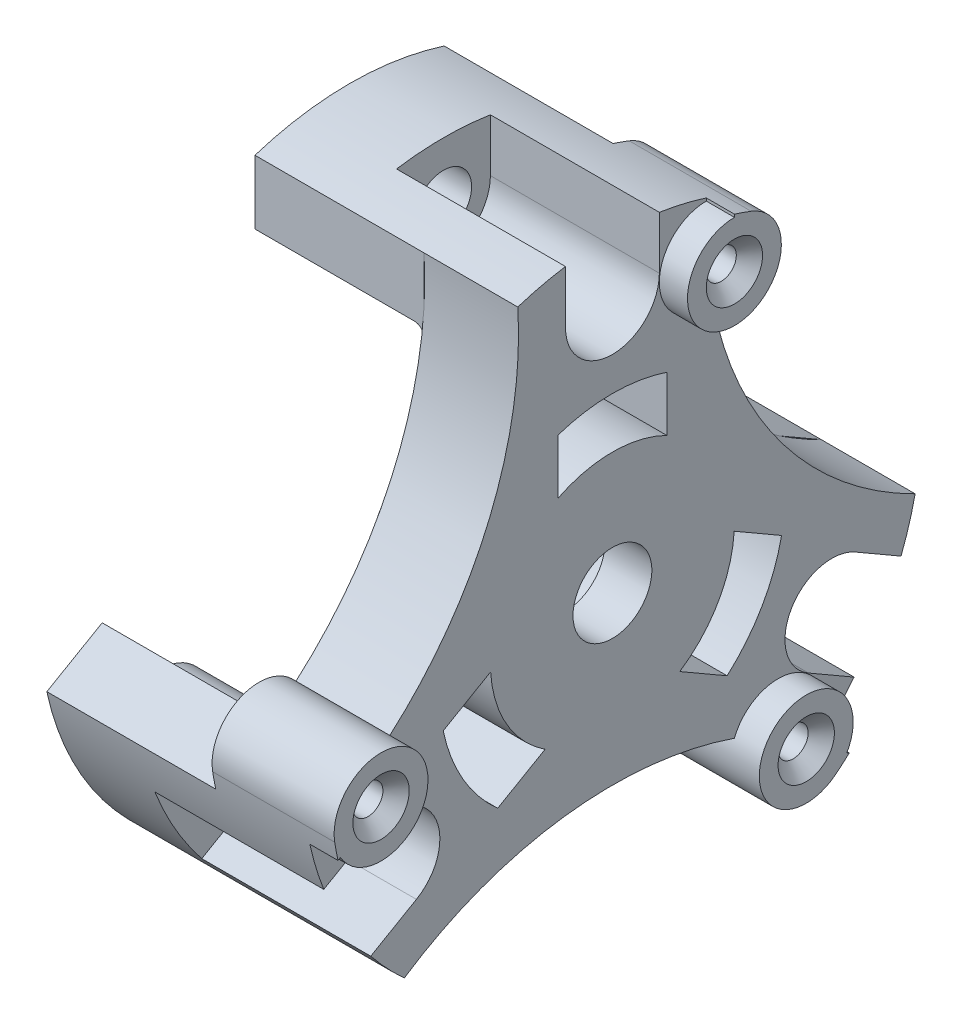
from build123d import *
from build123d.topology import SkipClean

# Parameters (mm, degrees)
SKETCH_2_R                           = 20
CUT_EXTRUDE_1_DEPTH                  = 10
PATTERN_CIRCULAR_1_COUNT             = 3
CUT_EXTRUDE_START                    = -10
CUT_EXTRUDE_2_DEPTH                  = 10
PATTERN_CIRCULAR_2_COUNT             = 3
SKETCH_4_R                           = 1.5
EXTRUDE_1_DEPTH                      = 9
PATTERN_CIRCULAR_3_COUNT             = 3
SKETCH_5_W                           = 6.1
SKETCH_5_H                           = 4.709181557
CUT_EXTRUDE_3_DEPTH                  = 1.5
CUT_EXTRUDE_3_DRAFT                  = -1
PATTERN_CIRCULAR_4_COPY_1_SKETCH_W   = 6.1
PATTERN_CIRCULAR_4_COPY_1_SKETCH_H   = 4.709181557
PATTERN_CIRCULAR_4_COPY_1_DEPTH      = 1.5
PATTERN_CIRCULAR_4_COPY_1_DRAFT      = -1
PATTERN_CIRCULAR_4_COPY_2_SKETCH_W   = 6.1
PATTERN_CIRCULAR_4_COPY_2_SKETCH_H   = 4.709181557
PATTERN_CIRCULAR_4_COPY_2_DEPTH      = 1.5
PATTERN_CIRCULAR_4_COPY_2_DRAFT      = -1
CUT_EXTRUDE_4_DEPTH                  = 9
PATTERN_CIRCULAR_5_COUNT             = 3
EXTRUDE_START                        = -6.5
EXTRUDE_2_DEPTH                      = 6.5
SKETCH_9_R                           = 0.8
CUT_EXTRUDE_7_DEPTH                  = 6.4
CHAMFER_3_SIZE                       = 0.7
PATTERN_CIRCULAR_8_COUNT             = 3
CHAMFER_3_OF_PATTERN_CIRCULAR_8_SIZE = 0.7
CHAMFER_4_SIZE                       = 0.3
FILLET_5_R                           = 0.2
FILLET_6_R                           = 0.5
FILLET_7_R                           = 0.5


with BuildPart() as part:
    # 草图1 → 旋转1 (revolve)
    with BuildSketch(Plane.XY, mode=Mode.PRIVATE) as revolve_1_sk:
        Polygon((-7, 6.5), (-5, 6.5), (-5, 16.5), (0, 16.5), (0, 2.1), (-2.5, 2.1), (-2.5, 4), (-7, 4), align=None)
    revolve(revolve_1_sk.sketch.rotate(Axis((-65.742857143, 0, 0), (1, 0, 0)), 90), axis=Axis((-65.742857143, 0, 0), (1, 0, 0)))

    # 草图2 → 切除-拉伸1 (cut)
    with BuildSketch(Plane.ZY.offset(5)):
        with Locations((-25, 14.43375673)):
            Circle(SKETCH_2_R)
    cut_extrude_1 = extrude(amount=-CUT_EXTRUDE_1_DEPTH, mode=Mode.SUBTRACT)

    # 阵列(圆周)1: 切除-拉伸1 ×3 about axis
    pattern_circular_1_axis = Axis((0, 0, 0), (1, 0, 0))
    for i in range(1, PATTERN_CIRCULAR_1_COUNT):
        add(cut_extrude_1.rotate(pattern_circular_1_axis, i * 360 / PATTERN_CIRCULAR_1_COUNT), mode=Mode.SUBTRACT)

    # 草图3 → 切除-拉伸2 (cut)
    with BuildSketch(Plane.ZY.offset(5).offset(CUT_EXTRUDE_START)):
        with BuildLine():
            Line((-2.9, 8.730979327), (-2.9, 5.817215829))
            ThreePointArc((-2.9, 5.817215829), (0, 6.5), (2.9, 5.817215829))
            Line((2.9, 5.817215829), (2.9, 8.730979327))
            ThreePointArc((2.9, 8.730979327), (0, 9.2), (-2.9, 8.730979327))
        make_face()
    cut_extrude_2 = extrude(amount=CUT_EXTRUDE_2_DEPTH, mode=Mode.SUBTRACT)

    # 阵列(圆周)2: 切除-拉伸2 ×3 about axis
    pattern_circular_2_axis = Axis((0, 0, 0), (1, 0, 0))
    for i in range(1, PATTERN_CIRCULAR_2_COUNT):
        add(cut_extrude_2.rotate(pattern_circular_2_axis, i * 360 / PATTERN_CIRCULAR_2_COUNT), mode=Mode.SUBTRACT)

    # 草图4 → 凸台-拉伸1 (add)
    with BuildSketch(Plane.ZY.offset(5)):
        with BuildLine():
            Line((-5.040834524, 15.711142139), (-5.040834524, 12.307720638))
            ThreePointArc((-5.040834524, 12.307720638), (-3.914741623, 12.710814216), (-2.756988875, 13.011111111))
            ThreePointArc((-2.756988875, 13.011111111), (0, 10.7), (2.756988875, 13.011111111))
            ThreePointArc((2.756988875, 13.011111111), (3.914741623, 12.710814216), (5.040834524, 12.307720638))
            Line((5.040834524, 12.307720638), (5.040834524, 15.711142139))
            ThreePointArc((5.040834524, 15.711142139), (0, 16.5), (-5.040834524, 15.711142139))
        make_face()
        with Locations((0, 13.5)):
            Circle(SKETCH_4_R, mode=Mode.SUBTRACT)
    extrude_1 = extrude(amount=EXTRUDE_1_DEPTH)

    # 阵列(圆周)3: 凸台-拉伸1 ×3 about axis
    pattern_circular_3_axis = Axis((0, 0, 0), (1, 0, 0))
    for i in range(1, PATTERN_CIRCULAR_3_COUNT):
        add(extrude_1.rotate(pattern_circular_3_axis, i * 360 / PATTERN_CIRCULAR_3_COUNT))


with BuildPart() as cut_extrude_3_tool:
    # 草图5 → 切除-拉伸3 (with draft: the straight prism first)
    with BuildSketch(Plane.ZY.offset(14)):
        with Locations((0, 11.645409221)):
            Rectangle(SKETCH_5_W, SKETCH_5_H)
    extrude(amount=-CUT_EXTRUDE_3_DEPTH)
    # 切除-拉伸3: the draft: its side faces are tilted about the plane it starts from
    cut_extrude_3_sides = [cut_extrude_3_tool.faces().sort_by_distance(p)[0] for p in [
        (-13.25, 11.645409222, -3.05),
        (-13.25, 9.290818443, 0),
        (-13.25, 11.645409222, 3.05),
        (-13.25, 14, 0),
    ]]
    draft(cut_extrude_3_sides, Plane.ZY.offset(14), CUT_EXTRUDE_3_DRAFT)


with BuildPart() as part_1:
    add(part.part)

    # 切除-拉伸3: cut by cut_extrude_3_tool
    add(cut_extrude_3_tool.part, mode=Mode.SUBTRACT)


with BuildPart() as pattern_circular_4_copy_1_tool:
    # 阵列(圆周)4 copy 1 sketch → 阵列(圆周)4 copy 1 (with draft: the straight prism first)
    with BuildSketch(Plane(origin=(-14, 0, 0), x_dir=(0, -0.8660254037844387, -0.4999999999999998), z_dir=(-1, 0, 0))):
        with Locations((0, 11.645409221)):
            Rectangle(PATTERN_CIRCULAR_4_COPY_1_SKETCH_W, PATTERN_CIRCULAR_4_COPY_1_SKETCH_H)
    extrude(amount=-PATTERN_CIRCULAR_4_COPY_1_DEPTH)
    # 阵列(圆周)4 copy 1: the draft: its side faces are tilted about the plane it starts from
    pattern_circular_4_copy_1_sides = [pattern_circular_4_copy_1_tool.faces().sort_by_distance(p)[0] for p in [
        (-13.25, -3.181327129, 11.610220224),
        (-13.25, -4.645409221, 8.046084794),
        (-13.25, -8.464082093, 8.560220224),
        (-13.25, -7, 12.124355653),
    ]]
    draft(pattern_circular_4_copy_1_sides, Plane(origin=(-14, 0, 0), x_dir=(0, -0.8660254037844387, -0.4999999999999998), z_dir=(-1, 0, 0)), PATTERN_CIRCULAR_4_COPY_1_DRAFT)


with BuildPart() as part_2:
    add(part_1.part)

    # 阵列(圆周)4 copy 1: cut by pattern_circular_4_copy_1_tool
    add(pattern_circular_4_copy_1_tool.part, mode=Mode.SUBTRACT)


with BuildPart() as pattern_circular_4_copy_2_tool:
    # 阵列(圆周)4 copy 2 sketch → 阵列(圆周)4 copy 2 (with draft: the straight prism first)
    with BuildSketch(Plane(origin=(-14, 0, 0), x_dir=(0, 0.8660254037844384, -0.5000000000000004), z_dir=(-1, 0, 0))):
        with Locations((0, 11.645409221)):
            Rectangle(PATTERN_CIRCULAR_4_COPY_2_SKETCH_W, PATTERN_CIRCULAR_4_COPY_2_SKETCH_H)
    extrude(amount=-PATTERN_CIRCULAR_4_COPY_2_DEPTH)
    # 阵列(圆周)4 copy 2: the draft: its side faces are tilted about the plane it starts from
    pattern_circular_4_copy_2_sides = [pattern_circular_4_copy_2_tool.faces().sort_by_distance(p)[0] for p in [
        (-13.25, -8.464082093, -8.560220224),
        (-13.25, -4.645409222, -8.046084794),
        (-13.25, -3.181327129, -11.610220224),
        (-13.25, -7, -12.124355653),
    ]]
    draft(pattern_circular_4_copy_2_sides, Plane(origin=(-14, 0, 0), x_dir=(0, 0.8660254037844384, -0.5000000000000004), z_dir=(-1, 0, 0)), PATTERN_CIRCULAR_4_COPY_2_DRAFT)


with BuildPart() as part_3:
    add(part_2.part)

    # 阵列(圆周)4 copy 2: cut by pattern_circular_4_copy_2_tool
    add(pattern_circular_4_copy_2_tool.part, mode=Mode.SUBTRACT)

    # 草图6 → 切除-拉伸4 (cut)
    with BuildSketch(Plane(origin=(0, 0, 0), x_dir=(0, 0, -1), z_dir=(1, 0, 0))):
        with BuildLine():
            Line((-2.5, 16.30950643), (-2.5, 13.5))
            ThreePointArc((-2.5, 13.5), (0, 11), (2.5, 13.5))
            Line((2.5, 13.5), (2.5, 16.30950643))
            ThreePointArc((2.5, 16.30950643), (0, 16.5), (-2.5, 16.30950643))
        make_face()
    cut_extrude_4 = extrude(amount=-CUT_EXTRUDE_4_DEPTH, mode=Mode.SUBTRACT)

    # 阵列(圆周)5: 切除-拉伸4 ×3 about axis
    pattern_circular_5_axis = Axis((0, 0, 0), (1, 0, 0))
    for i in range(1, PATTERN_CIRCULAR_5_COUNT):
        add(cut_extrude_4.rotate(pattern_circular_5_axis, i * 360 / PATTERN_CIRCULAR_5_COUNT), mode=Mode.SUBTRACT)

    # 草图7 → 凸台-拉伸2 (add)
    with BuildSketch(Plane.ZY.offset(5).offset(EXTRUDE_START)):
        with BuildLine():
            Line((-5, 15.576696831), (-5, 15.724185194))
            ThreePointArc((-5, 15.724185194), (-5.448667451, 15.574402814), (-5.892857143, 15.411821265))
            ThreePointArc((-5.892857143, 15.411821265), (-4.546023726, 10.618261242), (-5, 15.576696831))
        make_face()
    extrude_2 = extrude(amount=EXTRUDE_2_DEPTH)

    # 草图9 → 切除-拉伸7 (cut)
    with SkipClean():  # the faces are left unmerged after this step: merging them gives an invalid solid
        with BuildSketch(Plane(origin=(1.5, 0, 0), x_dir=(0, 0, -1), z_dir=(1, 0, 0))):
            with Locations((5, 13.076696831)):
                Circle(SKETCH_9_R)
        cut_extrude_7 = extrude(amount=-CUT_EXTRUDE_7_DEPTH, mode=Mode.SUBTRACT)

    # 倒角3
    chamfer_3_edges = [part_3.edges().sort_by_distance(p)[0] for p in [
        (1.5, 13.076696831, -4.2),
    ]]
    chamfer(chamfer_3_edges, length=CHAMFER_3_SIZE)

    # 阵列(圆周)8: 凸台-拉伸2, 切除-拉伸7 ×3 about axis
    with SkipClean():  # the faces are left unmerged after this step: merging them gives an invalid solid
        pattern_circular_8_axis = Axis((0, 0, 0), (1, 0, 0))
        add([extrude_2.rotate(pattern_circular_8_axis, i * 360 / PATTERN_CIRCULAR_8_COUNT) for i in range(1, PATTERN_CIRCULAR_8_COUNT)])
        add([cut_extrude_7.rotate(pattern_circular_8_axis, i * 360 / PATTERN_CIRCULAR_8_COUNT) for i in range(1, PATTERN_CIRCULAR_8_COUNT)], mode=Mode.SUBTRACT)

    # 倒角3 of 阵列(圆周)8
    chamfer_3_of_pattern_circular_8_edges = [part_3.edges().sort_by_distance(p)[0] for p in [
        (1.5, -2.901041719, 13.424751653),
        (1.5, -10.175655111, -9.224751653),
    ]]
    chamfer(chamfer_3_of_pattern_circular_8_edges, length=CHAMFER_3_OF_PATTERN_CIRCULAR_8_SIZE)

    # 倒角4
    chamfer_4_edges = [part_3.edges().sort_by_distance(p)[0] for p in [
        (-7, 0, -4),
    ]]
    chamfer(chamfer_4_edges, length=CHAMFER_4_SIZE)

    # 圆角5
    fillet_5_edges = [part_3.edges().sort_by_distance(p)[0] for p in [
        (-13.250000029, 12.948636435, 3.036908702),
        (-13.250000029, 12.948636435, -3.036908702),
        (-13.250000029, -9.104358302, 9.695393747),
        (-13.250000029, -3.844278133, 12.732302448),
        (-13.250000029, -3.844278133, -12.732302448),
        (-13.250000029, -9.104358302, -9.695393747),
    ]]
    fillet(fillet_5_edges, radius=FILLET_5_R)

    # 圆角6
    # the kernel refuses this fillet: 0.5 mm, written as the material it adds along each edge
    with BuildSketch(Plane(origin=(-5, 0, 0), x_dir=(0, 0.8857393976265326, -0.464182851355139), z_dir=(0, -0.464182851355139, -0.8857393976265326))) as fillet_6_piece_1_section:
        with BuildLine():
            CenterArc((13.3 - FILLET_6_R, -FILLET_6_R), FILLET_6_R, 0, 90)
            Line((13.3, -FILLET_6_R), (13.3, 0))
            Line((13.3, 0), (13.3 - FILLET_6_R, 0))
        make_face()
    fillet_6_piece_1 = revolve(axis=Axis((-5, 0, 0), (1, 0, 0)), revolution_arc=21.078593678, mode=Mode.PRIVATE)
    fillet_6_piece_1 = split(fillet_6_piece_1, bisect_by=Plane(origin=(-5.11248896, 12.576915206, -5.040834524), z_dir=(0, 0, 1)), keep=Keep.TOP, mode=Mode.PRIVATE)
    fillet_6_piece_1 = fillet_6_piece_1 - Plane(origin=(-5.11248896, 13.5, 0), x_dir=(0, -0.17460317460317398, -0.9846388837632271), z_dir=(1, 0, 0)) * Cylinder(2.8, 54, mode=Mode.PRIVATE)
    add(fillet_6_piece_1)
    with BuildSketch(Plane(origin=(-5, 13.5, 0), x_dir=(0, 0.26816925317072343, 0.9633718138153392), z_dir=(0, 0.9633718138153392, -0.26816925317072343))) as fillet_6_piece_2:
        with BuildLine():
            CenterArc((2.8 + FILLET_6_R, -FILLET_6_R), FILLET_6_R, 90, 90)
            Line((2.8, -FILLET_6_R), (2.8, 0))
            Line((2.8, 0), (2.8 + FILLET_6_R, 0))
        make_face()
    revolve(axis=Axis((-5, 13.5, 0), (1, 0, 0)), revolution_arc=211.110711493)
    with BuildSketch(Plane(origin=(-5, 0, 0), x_dir=(0, 0.9934153120018582, 0.11456883468138611), z_dir=(0, 0.11456883468138611, -0.9934153120018582))) as fillet_6_piece_3_section:
        with BuildLine():
            CenterArc((13.3 - FILLET_6_R, -FILLET_6_R), FILLET_6_R, 0, 90)
            Line((13.3, -FILLET_6_R), (13.3, 0))
            Line((13.3, 0), (13.3 - FILLET_6_R, 0))
        make_face()
    fillet_6_piece_3 = revolve(axis=Axis((-5, 0, 0), (1, 0, 0)), revolution_arc=21.078593678, mode=Mode.PRIVATE)
    fillet_6_piece_3 = split(fillet_6_piece_3, bisect_by=Plane(origin=(-5.112488964, 12.576915331, 5.040834524), z_dir=(0, 0, -1)), keep=Keep.TOP, mode=Mode.PRIVATE)
    fillet_6_piece_3 = fillet_6_piece_3 - Plane(origin=(-5.112488964, 13.5, 0), x_dir=(0, -0.17460317460317398, -0.9846388837632271), z_dir=(1, 0, 0)) * Cylinder(2.8, 54, mode=Mode.PRIVATE)
    add(fillet_6_piece_3)
    with BuildSketch(Plane(origin=(-5, 0, 0), x_dir=(0, -0.844863840087913, -0.5349813937997333), z_dir=(0, -0.5349813937997333, 0.844863840087913))) as fillet_6_piece_4_section:
        with BuildLine():
            CenterArc((13.3 - FILLET_6_R, -FILLET_6_R), FILLET_6_R, 0, 90)
            Line((13.3, -FILLET_6_R), (13.3, 0))
            Line((13.3, 0), (13.3 - FILLET_6_R, 0))
        make_face()
    fillet_6_piece_4 = revolve(axis=Axis((-5, 0, 0), (1, 0, 0)), revolution_arc=21.078593678, mode=Mode.PRIVATE)
    fillet_6_piece_4 = split(fillet_6_piece_4, bisect_by=Plane(origin=(-5.11248896, -10.653948357, -8.371510808), z_dir=(0, 0.8660254037844384, -0.5000000000000004)), keep=Keep.TOP, mode=Mode.PRIVATE)
    fillet_6_piece_4 = fillet_6_piece_4 - Plane(origin=(-5.11248896, -6.75, -11.691342951), x_dir=(0, -0.7654206995913203, 0.6435302266693725), z_dir=(1, 0, 0)) * Cylinder(2.8, 54, mode=Mode.PRIVATE)
    add(fillet_6_piece_4)
    with BuildSketch(Plane(origin=(-5, -6.75, -11.691342951), x_dir=(0, 0.7002198374686142, -0.713927292667417), z_dir=(0, -0.713927292667417, -0.7002198374686142))) as fillet_6_piece_5:
        with BuildLine():
            CenterArc((2.8 + FILLET_6_R, -FILLET_6_R), FILLET_6_R, 90, 90)
            Line((2.8, -FILLET_6_R), (2.8, 0))
            Line((2.8, 0), (2.8 + FILLET_6_R, 0))
        make_face()
    revolve(axis=Axis((-5, -6.75, -11.691342951), (1, 0, 0)), revolution_arc=211.110711493)
    with BuildSketch(Plane(origin=(-5, 0, 0), x_dir=(0, -0.39748813468486965, -0.9176073140427462), z_dir=(0, -0.9176073140427462, 0.39748813468486965))) as fillet_6_piece_6_section:
        with BuildLine():
            CenterArc((13.3 - FILLET_6_R, -FILLET_6_R), FILLET_6_R, 0, 90)
            Line((13.3, -FILLET_6_R), (13.3, 0))
            Line((13.3, 0), (13.3 - FILLET_6_R, 0))
        make_face()
    fillet_6_piece_6 = revolve(axis=Axis((-5, 0, 0), (1, 0, 0)), revolution_arc=21.078593678, mode=Mode.PRIVATE)
    fillet_6_piece_6 = split(fillet_6_piece_6, bisect_by=Plane(origin=(-5.112488964, -1.922966912, -13.412345439), z_dir=(0, -0.8660254037844384, 0.5000000000000004)), keep=Keep.TOP, mode=Mode.PRIVATE)
    fillet_6_piece_6 = fillet_6_piece_6 - Plane(origin=(-5.112488964, -6.75, -11.691342951), x_dir=(0, -0.7654206995913203, 0.6435302266693725), z_dir=(1, 0, 0)) * Cylinder(2.8, 54, mode=Mode.PRIVATE)
    add(fillet_6_piece_6)
    with BuildSketch(Plane(origin=(-5, 0, 0), x_dir=(0, -0.040875557538619156, 0.9991642451548729), z_dir=(0, 0.9991642451548729, 0.040875557538619156))) as fillet_6_piece_7_section:
        with BuildLine():
            CenterArc((13.3 - FILLET_6_R, -FILLET_6_R), FILLET_6_R, 0, 90)
            Line((13.3, -FILLET_6_R), (13.3, 0))
            Line((13.3, 0), (13.3 - FILLET_6_R, 0))
        make_face()
    fillet_6_piece_7 = revolve(axis=Axis((-5, 0, 0), (1, 0, 0)), revolution_arc=21.078593678, mode=Mode.PRIVATE)
    fillet_6_piece_7 = split(fillet_6_piece_7, bisect_by=Plane(origin=(-5.11248896, -1.922966849, 13.412345331), z_dir=(0, -0.8660254037844388, -0.49999999999999983)), keep=Keep.TOP, mode=Mode.PRIVATE)
    fillet_6_piece_7 = fillet_6_piece_7 - Plane(origin=(-5.11248896, -6.75, 11.691342951), x_dir=(0, 0.9400238741944947, 0.34110865709385474), z_dir=(1, 0, 0)) * Cylinder(2.8, 54, mode=Mode.PRIVATE)
    add(fillet_6_piece_7)
    with BuildSketch(Plane(origin=(-5, -6.75, 11.691342951), x_dir=(0, -0.9683890906393379, -0.24944452114792226), z_dir=(0, -0.24944452114792226, 0.9683890906393379))) as fillet_6_piece_8:
        with BuildLine():
            CenterArc((2.8 + FILLET_6_R, -FILLET_6_R), FILLET_6_R, 90, 90)
            Line((2.8, -FILLET_6_R), (2.8, 0))
            Line((2.8, 0), (2.8 + FILLET_6_R, 0))
        make_face()
    revolve(axis=Axis((-5, -6.75, 11.691342951), (1, 0, 0)), revolution_arc=211.110711493)
    with BuildSketch(Plane(origin=(-5, 0, 0), x_dir=(0, -0.5959271773169883, 0.8030384793613609), z_dir=(0, 0.8030384793613609, 0.5959271773169883))) as fillet_6_piece_9_section:
        with BuildLine():
            CenterArc((13.3 - FILLET_6_R, -FILLET_6_R), FILLET_6_R, 0, 90)
            Line((13.3 - FILLET_6_R, 0), (13.3, 0))
            Line((13.3, 0), (13.3, -FILLET_6_R))
        make_face()
    fillet_6_piece_9 = revolve(axis=Axis((-5, 0, 0), (1, 0, 0)), revolution_arc=21.078593678, mode=Mode.PRIVATE)
    fillet_6_piece_9 = split(fillet_6_piece_9, bisect_by=Plane(origin=(-5.112488962, -10.653948418, 8.371510914), z_dir=(0, 0.8660254037844388, 0.49999999999999983)), keep=Keep.TOP, mode=Mode.PRIVATE)
    fillet_6_piece_9 = fillet_6_piece_9 - Plane(origin=(-5.112488962, -6.75, 11.691342951), x_dir=(0, 0.9400238741944947, 0.34110865709385474), z_dir=(1, 0, 0)) * Cylinder(2.8, 54, mode=Mode.PRIVATE)
    add(fillet_6_piece_9)

    # 圆角7
    fillet_7_edges = [part_3.edges().sort_by_distance(p)[0] for p in [
        (-7, 0, -6.5),
    ]]
    fillet(fillet_7_edges, radius=FILLET_7_R)


solid = part_3.part
